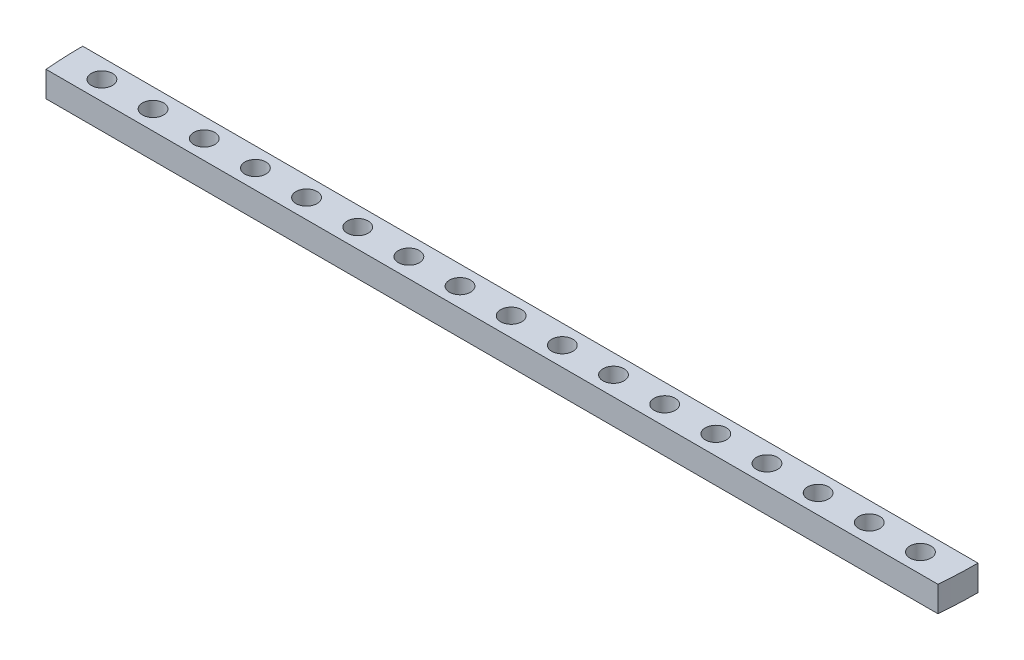
from build123d import *

# Parameters (mm, degrees)
EXTRUDE_1_DEPTH     = 4
CUT_EXTRUDE_1_DEPTH = 10
SKETCH_3_R          = 2.25
CUT_EXTRUDE_2_DEPTH = 10
SKETCH_4_R          = 1.65
CUT_EXTRUDE_3_DEPTH = 10
EXTRUDE_START       = -4
EXTRUDE_2_DEPTH     = 4
SKETCH_6_R          = 1.65
CUT_EXTRUDE_4_DEPTH = 4
SKETCH_7_W          = 40
SKETCH_7_H          = 10
SKETCH_7_R          = 2.25
CUT_EXTRUDE_5_DEPTH = 4
SKETCH_8_W          = 40
SKETCH_8_H          = 10
SKETCH_8_R          = 2.25
EXTRUDE_4_DEPTH     = 4
SKETCH_9_R          = 1.65
SKETCH_9_R_2        = 2.25
SKETCH_9_W          = 20
SKETCH_9_H          = 40
EXTRUDE_7_DEPTH     = 4
SKETCH_10_R         = 2.25
SKETCH_10_W         = 20
SKETCH_10_H         = 40
CUT_EXTRUDE_6_DEPTH = 4
SKETCH_11_W         = 181.165534537
SKETCH_11_H         = 160.340900773
CUT_EXTRUDE_7_DEPTH = 4


with BuildPart() as part:
    # 草图1 → 凸台-拉伸1 (new body)
    with BuildSketch(Plane(origin=(0, 0, 0), x_dir=(1, 0, 0), z_dir=(0, 1, 0))):
        with BuildLine():
            Line((-50, 0), (50, 0))
            ThreePointArc((50, 0), (0, -50), (-50, 0))
        make_face()
    extrude(amount=EXTRUDE_1_DEPTH)

    # 草图2 → 切除-拉伸1 (cut)
    with BuildSketch(Plane(origin=(0, 4, 0), x_dir=(1, 0, 0), z_dir=(0, 1, 0))):
        Polygon((0, -10.623043888), (10, -10.623043888), (10, -30.623043888), (-30, -30.623043888), (-30, -10.623043888), align=None)
    extrude(amount=-CUT_EXTRUDE_1_DEPTH, mode=Mode.SUBTRACT)

    # 草图3 → 切除-拉伸2 (cut)
    with BuildSketch(Plane(origin=(0, 4, 0), x_dir=(1, 0, 0), z_dir=(0, 1, 0))):
        with Locations((-34.75, -15.623043888)):
            Circle(SKETCH_3_R)
        with Locations((-34.75, -25.623043888)):
            Circle(SKETCH_3_R)
        with Locations((14.75, -25.623043888)):
            Circle(SKETCH_3_R)
        with Locations((14.75, -15.623043888)):
            Circle(SKETCH_3_R)
    extrude(amount=-CUT_EXTRUDE_2_DEPTH, mode=Mode.SUBTRACT)

    # 草图4 → 切除-拉伸3 (cut)
    with BuildSketch(Plane(origin=(0, 4, 0), x_dir=(1, 0, 0), z_dir=(0, 1, 0))):
        with Locations((0, -3)):
            Circle(SKETCH_4_R)
        with Locations((8, -3)):
            Circle(SKETCH_4_R)
        with Locations((16, -3)):
            Circle(SKETCH_4_R)
        with Locations((24, -3)):
            Circle(SKETCH_4_R)
        with Locations((32, -3)):
            Circle(SKETCH_4_R)
        with Locations((40, -3)):
            Circle(SKETCH_4_R)
        with Locations((-40, -3)):
            Circle(SKETCH_4_R)
        with Locations((-32, -3)):
            Circle(SKETCH_4_R)
        with Locations((-24, -3)):
            Circle(SKETCH_4_R)
        with Locations((-16, -3)):
            Circle(SKETCH_4_R)
        with Locations((-8, -3)):
            Circle(SKETCH_4_R)
    extrude(amount=-CUT_EXTRUDE_3_DEPTH, mode=Mode.SUBTRACT)

    # 草图5 → 凸台-拉伸2 (add)
    with BuildSketch(Plane(origin=(0, 4, 0), x_dir=(1, 0, 0), z_dir=(0, 1, 0)).offset(EXTRUDE_START)):
        with BuildLine():
            Line((-50, 0), (-70, 0))
            ThreePointArc((-70, 0), (0, -70), (70, 0))
            Line((70, 0), (50, 0))
            ThreePointArc((50, 0), (0, -50), (-50, 0))
        make_face()
    extrude(amount=EXTRUDE_2_DEPTH)

    # 草图6 → 切除-拉伸4 (cut)
    with BuildSketch(Plane(origin=(0, 4, 0), x_dir=(1, 0, 0), z_dir=(0, 1, 0))):
        with Locations((0, -3)):
            Circle(SKETCH_6_R)
        with Locations((8, -3)):
            Circle(SKETCH_6_R)
        with Locations((16, -3)):
            Circle(SKETCH_6_R)
        with Locations((24, -3)):
            Circle(SKETCH_6_R)
        with Locations((32, -3)):
            Circle(SKETCH_6_R)
        with Locations((40, -3)):
            Circle(SKETCH_6_R)
        with Locations((48, -3)):
            Circle(SKETCH_6_R)
        with Locations((56, -3)):
            Circle(SKETCH_6_R)
        with Locations((64, -3)):
            Circle(SKETCH_6_R)
        with Locations((-8, -3)):
            Circle(SKETCH_6_R)
        with Locations((-16, -3)):
            Circle(SKETCH_6_R)
        with Locations((-24, -3)):
            Circle(SKETCH_6_R)
        with Locations((-32, -3)):
            Circle(SKETCH_6_R)
        with Locations((-40, -3)):
            Circle(SKETCH_6_R)
        with Locations((-48, -3)):
            Circle(SKETCH_6_R)
        with Locations((-56, -3)):
            Circle(SKETCH_6_R)
        with Locations((-64, -3)):
            Circle(SKETCH_6_R)
    extrude(amount=-CUT_EXTRUDE_4_DEPTH, mode=Mode.SUBTRACT)

    # 草图7 → 切除-拉伸5 (cut)
    with BuildSketch(Plane(origin=(0, 4, 0), x_dir=(1, 0, 0), z_dir=(0, 1, 0))):
        with Locations((-10, -35.623043888)):
            Rectangle(SKETCH_7_W, SKETCH_7_H)
        with Locations((14.75, -35.623043888)):
            Circle(SKETCH_7_R)
        with Locations((-34.75, -35.623043888)):
            Circle(SKETCH_7_R)
    extrude(amount=-CUT_EXTRUDE_5_DEPTH, mode=Mode.SUBTRACT)

    # 草图8 → 凸台-拉伸4 (add)
    with BuildSketch(Plane(origin=(0, 4, 0), x_dir=(1, 0, 0), z_dir=(0, 1, 0))):
        with Locations((-10, -15.623043888)):
            Rectangle(SKETCH_8_W, SKETCH_8_H)
        with Locations((-34.75, -15.623043888)):
            Circle(SKETCH_8_R)
        with Locations((14.75, -15.623043888)):
            Circle(SKETCH_8_R)
    extrude(amount=-EXTRUDE_4_DEPTH)

    # 草图9 → 凸台-拉伸7 (add)
    # profile 1 of 2: a face of its own
    with BuildSketch(Plane(origin=(0, 4, 0), x_dir=(1, 0, 0), z_dir=(0, 1, 0))):
        with BuildLine():
            ThreePointArc((-80, -150), (-18.127603377, -112.738456532), (-22.125520932, -40.623043888))
            Line((-22.125520932, -40.623043888), (-30, -40.623043888))
            Line((-30, -40.623043888), (-30, -31.010205144))
            ThreePointArc((-30, -31.010205144), (-31.779769317, -29.257420711), (-33.620943969, -27.569253661))
            ThreePointArc((-33.620943969, -27.569253661), (-36.189210789, -27.352544482), (-36.868960897, -24.866403474))
            ThreePointArc((-36.868960897, -24.866403474), (-57.189385769, -13.820880344), (-80, -10))
            Line((-80, -10), (-80, -150))
        make_face()
        with Locations((-77, -144)):
            Circle(SKETCH_9_R, mode=Mode.SUBTRACT)
        with Locations((-77, -136)):
            Circle(SKETCH_9_R, mode=Mode.SUBTRACT)
        with Locations((-77, -128)):
            Circle(SKETCH_9_R, mode=Mode.SUBTRACT)
        with Locations((-77, -120)):
            Circle(SKETCH_9_R, mode=Mode.SUBTRACT)
        with Locations((-77, -112)):
            Circle(SKETCH_9_R, mode=Mode.SUBTRACT)
        with Locations((-77, -104)):
            Circle(SKETCH_9_R, mode=Mode.SUBTRACT)
        with Locations((-54.376956112, -114.75)):
            Circle(SKETCH_9_R_2, mode=Mode.SUBTRACT)
        with Locations((-44.376956112, -114.75)):
            Circle(SKETCH_9_R_2, mode=Mode.SUBTRACT)
        with Locations((-77, -96)):
            Circle(SKETCH_9_R, mode=Mode.SUBTRACT)
        with Locations((-77, -88)):
            Circle(SKETCH_9_R, mode=Mode.SUBTRACT)
        with Locations((-77, -80)):
            Circle(SKETCH_9_R, mode=Mode.SUBTRACT)
        with Locations((-49.376956112, -90)):
            Rectangle(SKETCH_9_W, SKETCH_9_H, mode=Mode.SUBTRACT)
        with Locations((-77, -72)):
            Circle(SKETCH_9_R, mode=Mode.SUBTRACT)
        with Locations((-77, -64)):
            Circle(SKETCH_9_R, mode=Mode.SUBTRACT)
        with Locations((-54.376956112, -65.25)):
            Circle(SKETCH_9_R_2, mode=Mode.SUBTRACT)
        with Locations((-44.376956112, -65.25)):
            Circle(SKETCH_9_R_2, mode=Mode.SUBTRACT)
        with Locations((-77, -56)):
            Circle(SKETCH_9_R, mode=Mode.SUBTRACT)
        with Locations((-77, -48)):
            Circle(SKETCH_9_R, mode=Mode.SUBTRACT)
        with Locations((-77, -40)):
            Circle(SKETCH_9_R, mode=Mode.SUBTRACT)
        with Locations((-77, -32)):
            Circle(SKETCH_9_R, mode=Mode.SUBTRACT)
        with Locations((-77, -24)):
            Circle(SKETCH_9_R, mode=Mode.SUBTRACT)
        with Locations((-77, -16)):
            Circle(SKETCH_9_R, mode=Mode.SUBTRACT)
        with Locations((-34.75, -35.623043888)):
            Circle(SKETCH_9_R_2, mode=Mode.SUBTRACT)
    # profile 2 of 2: a face of its own
    with BuildSketch(Plane(origin=(0, 4, 0), x_dir=(1, 0, 0), z_dir=(0, 1, 0))):
        with BuildLine():
            ThreePointArc((80, -10), (10, -80), (80, -150))
            Line((80, -150), (80, -80))
            Line((80, -80), (80, -10))
        make_face()
        with Locations((77, -144)):
            Circle(SKETCH_9_R, mode=Mode.SUBTRACT)
        with Locations((77, -136)):
            Circle(SKETCH_9_R, mode=Mode.SUBTRACT)
        with Locations((77, -128)):
            Circle(SKETCH_9_R, mode=Mode.SUBTRACT)
        with Locations((77, -120)):
            Circle(SKETCH_9_R, mode=Mode.SUBTRACT)
        with Locations((77, -112)):
            Circle(SKETCH_9_R, mode=Mode.SUBTRACT)
        with Locations((77, -104)):
            Circle(SKETCH_9_R, mode=Mode.SUBTRACT)
        with Locations((44.376956112, -94.75)):
            Circle(SKETCH_9_R_2, mode=Mode.SUBTRACT)
        with Locations((54.376956112, -94.75)):
            Circle(SKETCH_9_R_2, mode=Mode.SUBTRACT)
        with Locations((77, -96)):
            Circle(SKETCH_9_R, mode=Mode.SUBTRACT)
        with Locations((77, -88)):
            Circle(SKETCH_9_R, mode=Mode.SUBTRACT)
        with Locations((49.376956112, -70)):
            Rectangle(SKETCH_9_W, SKETCH_9_H, mode=Mode.SUBTRACT)
        with Locations((77, -80)):
            Circle(SKETCH_9_R, mode=Mode.SUBTRACT)
        with Locations((77, -72)):
            Circle(SKETCH_9_R, mode=Mode.SUBTRACT)
        with Locations((77, -64)):
            Circle(SKETCH_9_R, mode=Mode.SUBTRACT)
        with Locations((44.376956112, -45.25)):
            Circle(SKETCH_9_R_2, mode=Mode.SUBTRACT)
        with Locations((54.376956112, -45.25)):
            Circle(SKETCH_9_R_2, mode=Mode.SUBTRACT)
        with Locations((77, -56)):
            Circle(SKETCH_9_R, mode=Mode.SUBTRACT)
        with Locations((77, -48)):
            Circle(SKETCH_9_R, mode=Mode.SUBTRACT)
        with Locations((77, -40)):
            Circle(SKETCH_9_R, mode=Mode.SUBTRACT)
        with Locations((77, -32)):
            Circle(SKETCH_9_R, mode=Mode.SUBTRACT)
        with Locations((77, -24)):
            Circle(SKETCH_9_R, mode=Mode.SUBTRACT)
        with Locations((77, -16)):
            Circle(SKETCH_9_R, mode=Mode.SUBTRACT)
    extrude(amount=-EXTRUDE_7_DEPTH)

    # 草图10 → 切除-拉伸6 (cut)
    with BuildSketch(Plane(origin=(0, 4, 0), x_dir=(1, 0, 0), z_dir=(0, 1, 0))):
        with Locations((54.376956112, -45.25)):
            Circle(SKETCH_10_R)
        with Locations((44.376956112, -45.25)):
            Circle(SKETCH_10_R)
        with Locations((49.376956112, -70)):
            Rectangle(SKETCH_10_W, SKETCH_10_H)
    extrude(amount=-CUT_EXTRUDE_6_DEPTH, mode=Mode.SUBTRACT)

    # 草图11 → 切除-拉伸7 (cut)
    with BuildSketch(Plane.XZ):
        with Locations((5.537188422, 86.170450387)):
            Rectangle(SKETCH_11_W, SKETCH_11_H)
    extrude(amount=-CUT_EXTRUDE_7_DEPTH, mode=Mode.SUBTRACT)


solid = part.part
